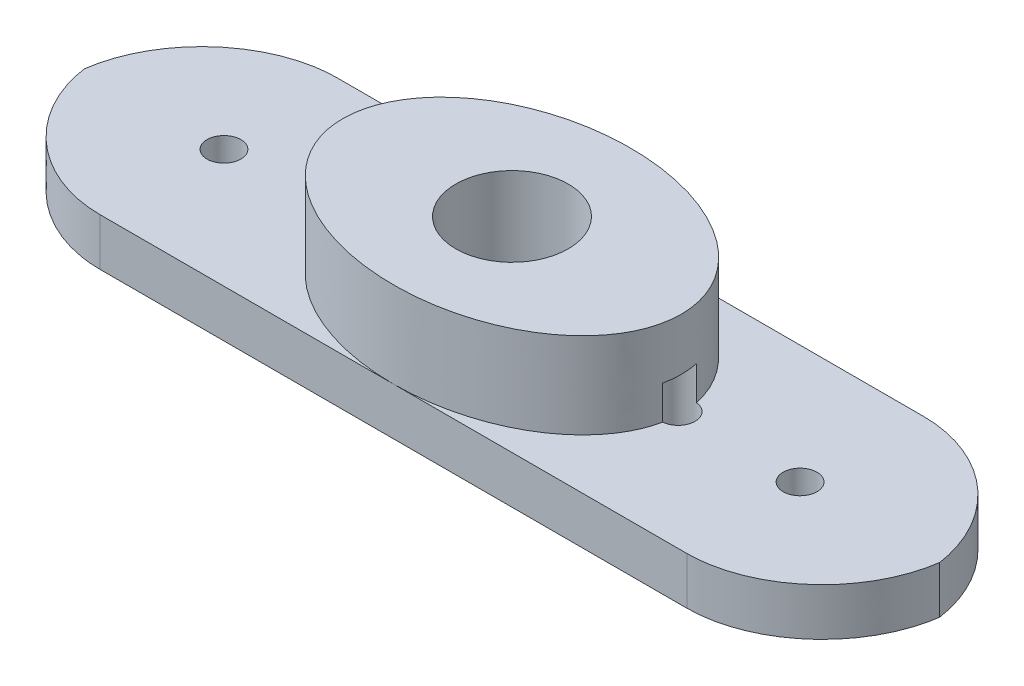
from build123d import *

# Parameters (mm, degrees)
SKETCH1_W               = 32.1564
SKETCH1_H               = 8.89
SKETCH1_R               = 1.2319
BOSS_EXTRUDE1_DEPTH     = 1.778
CUT_EXTRUDE1_DEPTH      = 32.409990197
CUT_EXTRUDE1_DEPTH_BACK = 34.409990197
CUT_EXTRUDE1_START      = 2
FILLET1_SIZE            = 5.08
SKETCH1_7_RX            = 6.35
SKETCH1_7_RY            = 4.445
BOSS_EXTRUDE2_DEPTH     = 5
CUT_EXTRUDE2_DEPTH      = 34.69313211
CUT_EXTRUDE2_DEPTH_BACK = 34.69313211
CUT_EXTRUDE3_DEPTH      = 1.27
CUT_EXTRUDE3_DEPTH_BACK = 12.7
SKETCH2_R               = 0.635


with BuildPart() as part:
    # Sketch1 → Boss-Extrude1 (new body)
    with BuildSketch(Plane(origin=(0, 0, 0), x_dir=(1, 0, 0), z_dir=(0, 1, 0))):
        with Locations((16.0782, 4.445)):
            Rectangle(SKETCH1_W, SKETCH1_H)
        with Locations(Location((16.0782, 4.445, 0), (0, 0, 270))):
            Circle(SKETCH1_R, mode=Mode.SUBTRACT)
    extrude(amount=BOSS_EXTRUDE1_DEPTH)

    # Sketch1<5> → Cut-Extrude1 (cut, two sides: drawn at the far end of the back side and taken through both)
    with BuildSketch(Plane(origin=(0, 0, 0), x_dir=(1, 0, 0), z_dir=(0, 1, 0)).offset(CUT_EXTRUDE1_START - CUT_EXTRUDE1_DEPTH_BACK)):
        with BuildLine():
            ThreePointArc((18.1864, 4.445), (17.568922516, 5.935722516), (16.0782, 6.5532))
            Line((16.0782, 6.5532), (16.0782, 5.6769))
            ThreePointArc((16.0782, 5.6769), (16.949284844, 5.316084844), (17.3101, 4.445))
            ThreePointArc((17.3101, 4.445), (16.949284844, 3.573915156), (16.0782, 3.2131))
            Line((16.0782, 3.2131), (16.0782, 2.3368))
            ThreePointArc((16.0782, 2.3368), (17.568922516, 2.954277484), (18.1864, 4.445))
        make_face()
        with BuildLine():
            Line((16.0782, 5.6769), (16.0782, 6.5532))
            ThreePointArc((16.0782, 6.5532), (13.97, 4.445), (16.0782, 2.3368))
            Line((16.0782, 2.3368), (16.0782, 3.2131))
            ThreePointArc((16.0782, 3.2131), (14.8463, 4.445), (16.0782, 5.6769))
        make_face()
        with BuildLine():
            ThreePointArc((17.3101, 4.445), (16.949284844, 5.316084844), (16.0782, 5.6769))
            Line((16.0782, 5.6769), (16.0782, 3.2131))
            ThreePointArc((16.0782, 3.2131), (16.949284844, 3.573915156), (17.3101, 4.445))
        make_face()
        with BuildLine():
            Line((16.0782, 3.2131), (16.0782, 5.6769))
            ThreePointArc((16.0782, 5.6769), (14.8463, 4.445), (16.0782, 3.2131))
        make_face()
    extrude(amount=CUT_EXTRUDE1_DEPTH + CUT_EXTRUDE1_DEPTH_BACK, mode=Mode.SUBTRACT)

    # Fillet1
    # a fillet whose section is not a circle: 5.08 mm, written as the material it takes off along each edge
    with BuildSketch(Plane(origin=(32.1564, -12.7, -8.89), x_dir=(0, 0, 1), z_dir=(0, 1, 0)), Plane(origin=(32.1564, -12.7, 0), x_dir=(-1, 0, 0), z_dir=(0, 1, 0))) as fillet1_piece_1:
        with BuildLine():
            Bezier((FILLET1_SIZE, 0), (0, 0), (0, -FILLET1_SIZE), weights=[1, 0.666666667, 1])
            Line((0, -FILLET1_SIZE), (0, 0))
            Line((0, 0), (FILLET1_SIZE, 0))
        make_face()
    extrude(amount=27.178, mode=Mode.SUBTRACT)
    with BuildSketch(Plane(origin=(0, -12.7, -8.89), x_dir=(0, 0, 1), z_dir=(0, 1, 0)), Plane(origin=(0, -12.7, 0), x_dir=(1, 0, 0), z_dir=(0, 1, 0))) as fillet1_piece_2:
        with BuildLine():
            Bezier((FILLET1_SIZE, 0), (0, 0), (0, FILLET1_SIZE), weights=[1, 0.666666667, 1])
            Line((0, FILLET1_SIZE), (0, 0))
            Line((0, 0), (FILLET1_SIZE, 0))
        make_face()
    extrude(amount=27.178, mode=Mode.SUBTRACT)

    # Sketch1<7> → Boss-Extrude2 (add)
    with BuildSketch(Plane(origin=(0, 0, 0), x_dir=(1, 0, 0), z_dir=(0, 1, 0))):
        with Locations(Location((16.0782, 4.445), (0, 0, 0))):
            Ellipse(SKETCH1_7_RX, SKETCH1_7_RY)
    extrude(amount=BOSS_EXTRUDE2_DEPTH)

    # Sketch1<8> → Cut-Extrude2 (cut, two sides: drawn at the far end of the back side and taken through both)
    with BuildSketch(Plane(origin=(0, 0, 0), x_dir=(1, 0, 0), z_dir=(0, 1, 0)).offset(-CUT_EXTRUDE2_DEPTH_BACK)):
        with BuildLine():
            ThreePointArc((18.1864, 4.445), (17.568922516, 5.935722516), (16.0782, 6.5532))
            Line((16.0782, 6.5532), (16.0782, 5.6769))
            ThreePointArc((16.0782, 5.6769), (16.949284844, 5.316084844), (17.3101, 4.445))
            ThreePointArc((17.3101, 4.445), (16.949284844, 3.573915156), (16.0782, 3.2131))
            Line((16.0782, 3.2131), (16.0782, 2.3368))
            ThreePointArc((16.0782, 2.3368), (17.568922516, 2.954277484), (18.1864, 4.445))
        make_face()
        with BuildLine():
            Line((16.0782, 5.6769), (16.0782, 6.5532))
            ThreePointArc((16.0782, 6.5532), (13.97, 4.445), (16.0782, 2.3368))
            Line((16.0782, 2.3368), (16.0782, 3.2131))
            ThreePointArc((16.0782, 3.2131), (14.8463, 4.445), (16.0782, 5.6769))
        make_face()
    extrude(amount=CUT_EXTRUDE2_DEPTH + CUT_EXTRUDE2_DEPTH_BACK, mode=Mode.SUBTRACT)


with BuildPart() as cut_extrude2_kept_piece:
    # of the separate pieces the step leaves, the one the design keeps (cut_extrude2_pieces_kept)
    add(part.part.solids().sort_by_distance((5.08, 0, 0))[0])

    # Sketch2 → Cut-Extrude3 (cut, two sides: drawn at the far end of the back side and taken through both)
    with BuildSketch(Plane(origin=(0, 1.778, 0), x_dir=(1, 0, 0), z_dir=(0, 1, 0)).offset(-CUT_EXTRUDE3_DEPTH_BACK)):
        with Locations(Location((9.848128616, 4.444938826, 0), (0, 0, 94.99673829))):
            Circle(SKETCH2_R)
        with Locations(Location((5.276128616, 4.444938826, 0), (0, 0, 270))):
            Circle(SKETCH2_R)
        with Locations(Location((22.308288089, 4.444938826, 0), (0, 0, 85.004802362))):
            Circle(SKETCH2_R)
        with Locations(Location((26.880288089, 4.444938826, 0), (0, 0, 270))):
            Circle(SKETCH2_R)
    extrude(amount=CUT_EXTRUDE3_DEPTH + CUT_EXTRUDE3_DEPTH_BACK, mode=Mode.SUBTRACT)


solid = cut_extrude2_kept_piece.part
